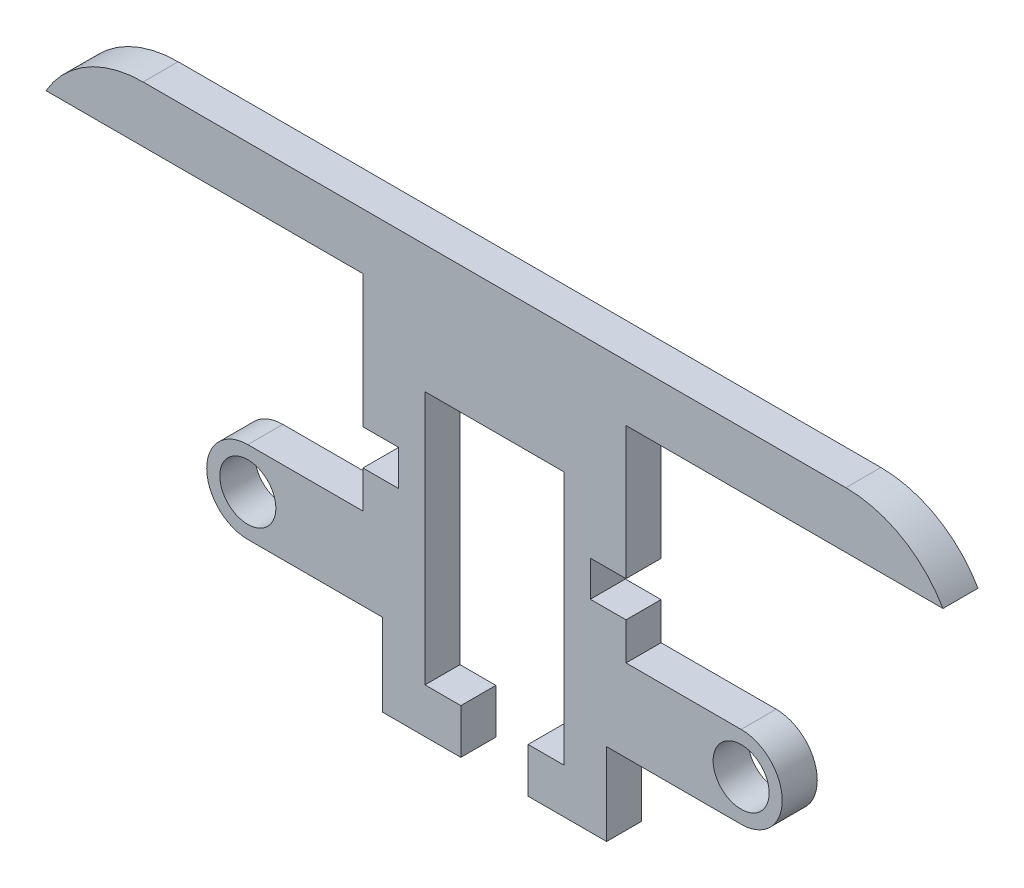
from build123d import *

# Parameters (mm, degrees)
SKETCH1_R           = 2.5
BOSS_EXTRUDE1_DEPTH = 3.125
FILLET1_R           = 10


with BuildPart() as part:
    # Sketch1 → Boss-Extrude1 (new body)
    with BuildSketch(Plane.XY):
        with BuildLine():
            Line((0, 19), (40, 19))
            Line((40, 19), (40, 14))
            Line((40, 14), (11.73, 14))
            Line((11.73, 14), (11.73, 2.17))
            Line((11.73, 2.17), (8.55, 2.17))
            Line((8.55, 2.17), (8.55, -1.01))
            Line((8.55, -1.01), (11.73, -1.01))
            Line((11.73, -1.01), (11.73, -4.34))
            Line((11.73, -4.34), (22, -4.34))
            ThreePointArc((22, -4.34), (25.665, -8.005), (22, -11.67))
            Line((22, -11.67), (10, -11.67))
            Line((10, -11.67), (10, -19))
            Line((10, -19), (3, -19))
            Line((3, -19), (3, -15))
            Line((3, -15), (6.2, -15))
            Line((6.2, -15), (6.2, 7.65))
            Line((6.2, 7.65), (0, 7.65))
            Line((0, 7.65), (0, 19))
        make_face()
        with Locations((22, -8.005)):
            Circle(SKETCH1_R, mode=Mode.SUBTRACT)
    boss_extrude1 = extrude(amount=BOSS_EXTRUDE1_DEPTH)

    # Mirror1: Boss-Extrude1 across plane
    add(boss_extrude1.mirror(Plane(origin=(0, 19, 3.125), x_dir=(0, 0, 1), z_dir=(1, 0, 0))))

    # Fillet1
    # the kernel refuses this fillet: 10 mm, written as the material it takes off along each edge
    with BuildSketch(Plane(origin=(-40, 19, -21.650635095), x_dir=(1, 0, 0), z_dir=(0, 0, 1))) as fillet1_piece_1:
        with BuildLine():
            CenterArc((8.660254038, -10), FILLET1_R, 90, 60)
            Line((0, -5), (-0.173205081, -4.9))
            ThreePointArc((-0.173205081, -4.9), (-0.2, -2.5), (-0.2, 0))
            Line((-0.2, 0), (0, 0.2))
            Line((0, 0.2), (8.660254038, 0.2))
            Line((8.660254038, 0.2), (8.660254038, 0))
        make_face()
    extrude(amount=46.426270189, mode=Mode.SUBTRACT)
    with BuildSketch(Plane(origin=(40, 19, -21.650635095), x_dir=(-1, 0, 0), z_dir=(0, 0, 1))) as fillet1_piece_2:
        with BuildLine():
            CenterArc((8.660254038, 10), FILLET1_R, 210, 60)
            Line((0, 5), (-0.173205081, 4.9))
            ThreePointArc((-0.173205081, 4.9), (-0.2, 2.5), (-0.2, 0))
            Line((-0.2, 0), (0, -0.2))
            Line((0, -0.2), (8.660254038, -0.2))
            Line((8.660254038, -0.2), (8.660254038, 0))
        make_face()
    extrude(amount=46.426270189, mode=Mode.SUBTRACT)


solid = part.part
